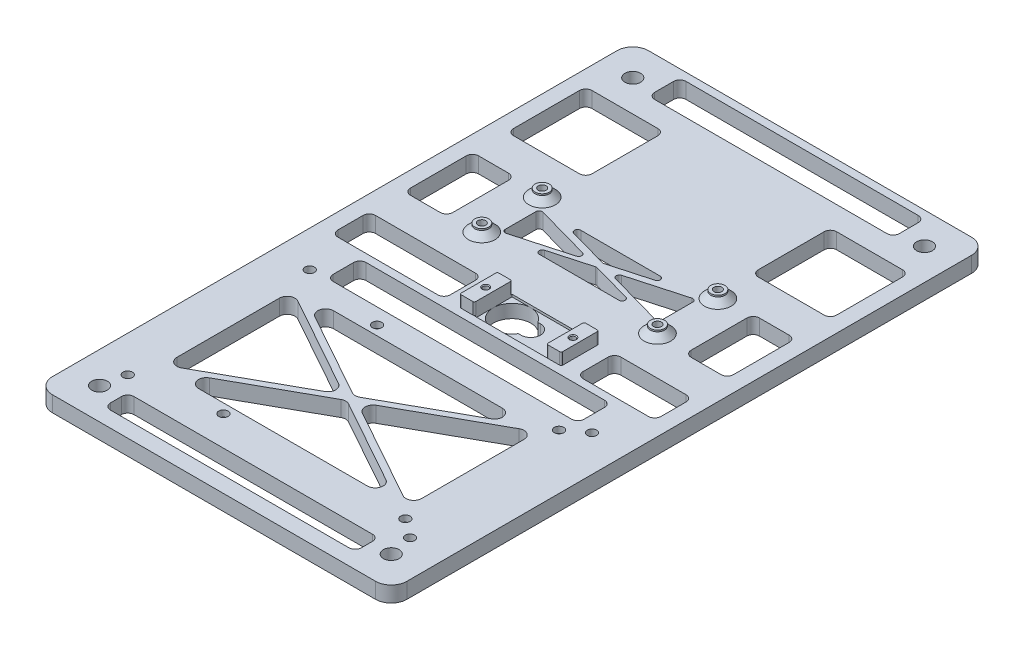
from build123d import *

# Parameters (mm, degrees)
SKETCH1_W           = 113
SKETCH1_H           = 190
SKETCH1_R           = 2.5
BOSS_EXTRUDE1_DEPTH = 5
FILLET1_R           = 5
SKETCH2_R           = 1.5
CUT_EXTRUDE1_DEPTH  = 10
SKETCH3_R           = 1.5
CUT_EXTRUDE2_DEPTH  = 10
CUT_EXTRUDE4_DEPTH  = 10
CUT_EXTRUDE16_DEPTH = 111.644701635
SKETCH22_W          = 23
SKETCH22_H          = 12
CUT_EXTRUDE17_DEPTH = 0.75
SKETCH23_W          = 4.675
SKETCH23_H          = 12
SKETCH23_R          = 0.875
BOSS_EXTRUDE5_DEPTH = 3.75
CUT_EXTRUDE18_START = -1.5
SKETCH24_R          = 0.875
CUT_EXTRUDE18_DEPTH = 1.5
SKETCH12_W          = 25
SKETCH12_H          = 25
CUT_EXTRUDE9_DEPTH  = 111.644701635
CUT_EXTRUDE11_REACH = 112.645
SKETCH15_W          = 35.825
SKETCH15_H          = 12
SKETCH15_W_2        = 24.825
FILLET3_R           = 2
CUT_EXTRUDE12_REACH = 112.877
SKETCH16_R          = 1.25
CUT_EXTRUDE13_REACH = 112.645
CUT_EXTRUDE14_DEPTH = 111.644701635
SKETCH19_R          = 2.25
SKETCH19_R_2        = 1.25
BOSS_EXTRUDE4_DEPTH = 2.5
CHAMFER1_SIZE       = 2
SKETCH20_R          = 2.5
CUT_EXTRUDE15_DEPTH = 3
FILLET4_R           = 0.5
CHAMFER2_SIZE       = 0.25


with BuildPart() as part:
    # Sketch1 → Boss-Extrude1 (new body)
    with BuildSketch(Plane(origin=(0, 0, 0), x_dir=(1, 0, 0), z_dir=(0, 1, 0))):
        Rectangle(SKETCH1_W, SKETCH1_H)
        with Locations((46.5, 85)):
            Circle(SKETCH1_R, mode=Mode.SUBTRACT)
        with Locations((-46.5, 85)):
            Circle(SKETCH1_R, mode=Mode.SUBTRACT)
        with Locations((-46.5, -85)):
            Circle(SKETCH1_R, mode=Mode.SUBTRACT)
        with Locations((46.5, -85)):
            Circle(SKETCH1_R, mode=Mode.SUBTRACT)
    extrude(amount=BOSS_EXTRUDE1_DEPTH)

    # Fillet1
    fillet1_edges = [part.edges().sort_by_distance(p)[0] for p in [
        (-56.5, 2.5, 95),
        (-56.5, 2.5, -95),
        (56.5, 2.5, -95),
        (56.5, 2.5, 95),
    ]]
    fillet(fillet1_edges, radius=FILLET1_R)

    # Sketch2 → Cut-Extrude1 (cut)
    with BuildSketch(Plane(origin=(0, 5, 0), x_dir=(1, 0, 0), z_dir=(0, 1, 0))):
        with Locations((39, -24)):
            Circle(SKETCH2_R)
        with Locations((39, -73)):
            Circle(SKETCH2_R)
        with Locations((-19, -24)):
            Circle(SKETCH2_R)
        with Locations((-19, -73)):
            Circle(SKETCH2_R)
    extrude(amount=-CUT_EXTRUDE1_DEPTH, mode=Mode.SUBTRACT)

    # Sketch3 → Cut-Extrude2 (cut)
    with BuildSketch(Plane(origin=(0, 5, 0), x_dir=(1, 0, 0), z_dir=(0, 1, 0))):
        with Locations((45, -19.5)):
            Circle(SKETCH3_R)
        with Locations((45, -77.5)):
            Circle(SKETCH3_R)
        with Locations((-45, -19.5)):
            Circle(SKETCH3_R)
        with Locations((-45, -77.5)):
            Circle(SKETCH3_R)
    extrude(amount=-CUT_EXTRUDE2_DEPTH, mode=Mode.SUBTRACT)

    # Sketch5 → Cut-Extrude4 (cut)
    with BuildSketch(Plane(origin=(0, 5, 0), x_dir=(1, 0, 0), z_dir=(0, 1, 0))):
        with BuildLine():
            Line((-38, -90), (38, -90))
            ThreePointArc((38, -90), (39.414213562, -89.414213562), (40, -88))
            Line((40, -88), (40, -84.5))
            ThreePointArc((40, -84.5), (39.414213562, -83.085786438), (38, -82.5))
            Line((38, -82.5), (-38, -82.5))
            ThreePointArc((-38, -82.5), (-39.414213562, -83.085786438), (-40, -84.5))
            Line((-40, -84.5), (-40, -88))
            ThreePointArc((-40, -88), (-39.414213562, -89.414213562), (-38, -90))
        make_face()
    extrude(amount=-CUT_EXTRUDE4_DEPTH, mode=Mode.SUBTRACT)

    # Sketch21 → Cut-Extrude16 (cut, through all)
    with BuildSketch(Plane(origin=(0, 5, 0), x_dir=(1, 0, 0), z_dir=(0, 1, 0))):
        with BuildLine():
            Line((5.975, -3.125), (5.121950312, -3.125))
            ThreePointArc((5.121950312, -3.125), (-6, 0), (5.121950312, 3.125))
            Line((5.121950312, 3.125), (5.975, 3.125))
            ThreePointArc((5.975, 3.125), (9.1, 0), (5.975, -3.125))
        make_face()
    extrude(amount=-CUT_EXTRUDE16_DEPTH, mode=Mode.SUBTRACT)

    # Sketch22 → Cut-Extrude17 (cut)
    with BuildSketch(Plane(origin=(0, 5, 0), x_dir=(1, 0, 0), z_dir=(0, 1, 0))):
        with Locations((5.5, 0)):
            Rectangle(SKETCH22_W, SKETCH22_H)
    extrude(amount=-CUT_EXTRUDE17_DEPTH, mode=Mode.SUBTRACT)

    # Sketch23 → Boss-Extrude5 (add)
    # profile 1 of 2: a face of its own
    with BuildSketch(Plane(origin=(0, 5, 0), x_dir=(1, 0, 0), z_dir=(0, 1, 0))):
        with Locations((-8.3375, 0)):
            Rectangle(SKETCH23_W, SKETCH23_H)
        with Locations((-8.4, 0)):
            Circle(SKETCH23_R, mode=Mode.SUBTRACT)
    # profile 2 of 2: a face of its own
    with BuildSketch(Plane(origin=(0, 5, 0), x_dir=(1, 0, 0), z_dir=(0, 1, 0))):
        with Locations((19.3375, 0)):
            Rectangle(SKETCH23_W, SKETCH23_H)
        with Locations((19.4, 0)):
            Circle(SKETCH23_R, mode=Mode.SUBTRACT)
    extrude(amount=BOSS_EXTRUDE5_DEPTH)

    # Sketch24 → Cut-Extrude18 (cut)
    with BuildSketch(Plane(origin=(0, 5, 0), x_dir=(1, 0, 0), z_dir=(0, 1, 0)).offset(CUT_EXTRUDE18_START)):
        with Locations((19.4, 0)):
            Circle(SKETCH24_R)
        with Locations((-8.4, 0)):
            Circle(SKETCH24_R)
    extrude(amount=CUT_EXTRUDE18_DEPTH, mode=Mode.SUBTRACT)

    # Sketch12 → Cut-Extrude9 (cut, through all)
    with BuildSketch(Plane(origin=(0, 5, 0), x_dir=(1, 0, 0), z_dir=(0, 1, 0))):
        with Locations((-39, 62.5)):
            Rectangle(SKETCH12_W, SKETCH12_H)
        with Locations((39, 62.5)):
            Rectangle(SKETCH12_W, SKETCH12_H)
    extrude(amount=-CUT_EXTRUDE9_DEPTH, mode=Mode.SUBTRACT)

    # Sketch15 → Cut-Extrude11 (cut, up to next)
    with BuildSketch(Plane(origin=(0, 5, 0), x_dir=(1, 0, 0), z_dir=(0, 1, 0)), mode=Mode.PRIVATE) as cut_extrude11_sk1:
        with Locations((-33.5875, 0)):
            Rectangle(SKETCH15_W, SKETCH15_H)
    cut_extrude11_tool1 = extrude(cut_extrude11_sk1.sketch, amount=-CUT_EXTRUDE11_REACH, mode=Mode.PRIVATE) & part.part
    # Sketch15 → Cut-Extrude11 (cut, up to next)
    with BuildSketch(Plane(origin=(0, 5, 0), x_dir=(1, 0, 0), z_dir=(0, 1, 0)), mode=Mode.PRIVATE) as cut_extrude11_sk2:
        with Locations((39.0875, 0)):
            Rectangle(SKETCH15_W_2, SKETCH15_H)
    cut_extrude11_tool2 = extrude(cut_extrude11_sk2.sketch, amount=-CUT_EXTRUDE11_REACH, mode=Mode.PRIVATE) & part.part
    add(cut_extrude11_tool1.solids().sort_by_distance((-33.5875, 5, 0))[0], mode=Mode.SUBTRACT)
    add(cut_extrude11_tool2.solids().sort_by_distance((39.0875, 5, 0))[0], mode=Mode.SUBTRACT)

    # Fillet3
    fillet3_edges = [part.edges().sort_by_distance(p)[0] for p in [
        (-51.5, 2.5, 6),
        (-51.5, 2.5, -6),
        (-15.675, 2.5, -6),
        (-15.675, 2.5, 6),
        (51.5, 2.5, -6),
        (26.675, 2.5, -6),
        (26.675, 2.5, 6),
        (51.5, 2.5, 6),
        (51.5, 2.5, -50),
        (51.5, 2.5, -75),
        (26.5, 2.5, -50),
        (26.5, 2.5, -75),
        (-26.5, 2.5, -50),
        (-51.5, 2.5, -50),
        (-51.5, 2.5, -75),
        (-26.5, 2.5, -75),
    ]]
    fillet(fillet3_edges, radius=FILLET3_R)

    # Sketch16 → Cut-Extrude12 (cut, up to next)
    with BuildSketch(Plane.XZ, mode=Mode.PRIVATE) as cut_extrude12_sk1:
        with Locations((-28, -18.375)):
            Circle(SKETCH16_R)
    cut_extrude12_tool1 = extrude(cut_extrude12_sk1.sketch, amount=-CUT_EXTRUDE12_REACH, mode=Mode.PRIVATE) & part.part
    # Sketch16 → Cut-Extrude12 (cut, up to next)
    with BuildSketch(Plane.XZ, mode=Mode.PRIVATE) as cut_extrude12_sk2:
        with Locations((28, -18.375)):
            Circle(SKETCH16_R)
    cut_extrude12_tool2 = extrude(cut_extrude12_sk2.sketch, amount=-CUT_EXTRUDE12_REACH, mode=Mode.PRIVATE) & part.part
    # Sketch16 → Cut-Extrude12 (cut, up to next)
    with BuildSketch(Plane.XZ, mode=Mode.PRIVATE) as cut_extrude12_sk3:
        with Locations((28, -37.625)):
            Circle(SKETCH16_R)
    cut_extrude12_tool3 = extrude(cut_extrude12_sk3.sketch, amount=-CUT_EXTRUDE12_REACH, mode=Mode.PRIVATE) & part.part
    # Sketch16 → Cut-Extrude12 (cut, up to next)
    with BuildSketch(Plane.XZ, mode=Mode.PRIVATE) as cut_extrude12_sk4:
        with Locations((-28, -37.625)):
            Circle(SKETCH16_R)
    cut_extrude12_tool4 = extrude(cut_extrude12_sk4.sketch, amount=-CUT_EXTRUDE12_REACH, mode=Mode.PRIVATE) & part.part
    # Sketch16 → Cut-Extrude12 (cut, up to next)
    with BuildSketch(Plane.XZ, mode=Mode.PRIVATE) as cut_extrude12_sk5:
        with BuildLine():
            Line((-42, 64.8228648), (-42, 32.1771352))
            ThreePointArc((-42, 32.1771352), (-40.766661958, 30.021777345), (-38.283546013, 29.993047359))
            Line((-38.283546013, 29.993047359), (-8.976584213, 46.315912159))
            ThreePointArc((-8.976584213, 46.315912159), (-7.6930382, 48.5), (-8.976584213, 50.684087841))
            Line((-8.976584213, 50.684087841), (-38.283546013, 67.006952641))
            ThreePointArc((-38.283546013, 67.006952641), (-40.766661958, 66.978222655), (-42, 64.8228648))
        make_face()
    cut_extrude12_tool5 = extrude(cut_extrude12_sk5.sketch, amount=-CUT_EXTRUDE12_REACH, mode=Mode.PRIVATE) & part.part
    # Sketch16 → Cut-Extrude12 (cut, up to next)
    with BuildSketch(Plane.XZ, mode=Mode.PRIVATE) as cut_extrude12_sk6:
        with BuildLine():
            Line((-31.13705215, 31.684087841), (-4.216453987, 46.677838717))
            ThreePointArc((-4.216453987, 46.677838717), (-3, 46.993750876), (-1.783546013, 46.677838717))
            Line((-1.783546013, 46.677838717), (25.13705215, 31.684087841))
            ThreePointArc((25.13705215, 31.684087841), (26.340331578, 28.871597105), (23.920598163, 27))
            Line((23.920598163, 27), (-29.920598163, 27))
            ThreePointArc((-29.920598163, 27), (-32.340331578, 28.871597105), (-31.13705215, 31.684087841))
        make_face()
    cut_extrude12_tool6 = extrude(cut_extrude12_sk6.sketch, amount=-CUT_EXTRUDE12_REACH, mode=Mode.PRIVATE) & part.part
    # Sketch16 → Cut-Extrude12 (cut, up to next)
    with BuildSketch(Plane.XZ, mode=Mode.PRIVATE) as cut_extrude12_sk7:
        with BuildLine():
            Line((32.283546013, 29.993047359), (2.976584213, 46.315912159))
            ThreePointArc((2.976584213, 46.315912159), (1.6930382, 48.5), (2.976584213, 50.684087841))
            Line((2.976584213, 50.684087841), (32.283546013, 67.006952641))
            ThreePointArc((32.283546013, 67.006952641), (34.766661958, 66.978222655), (36, 64.8228648))
            Line((36, 64.8228648), (36, 32.1771352))
            ThreePointArc((36, 32.1771352), (34.766661958, 30.021777345), (32.283546013, 29.993047359))
        make_face()
    cut_extrude12_tool7 = extrude(cut_extrude12_sk7.sketch, amount=-CUT_EXTRUDE12_REACH, mode=Mode.PRIVATE) & part.part
    # Sketch16 → Cut-Extrude12 (cut, up to next)
    with BuildSketch(Plane.XZ, mode=Mode.PRIVATE) as cut_extrude12_sk8:
        with BuildLine():
            Line((-1.783546013, 50.322161283), (25.13705215, 65.315912159))
            ThreePointArc((25.13705215, 65.315912159), (26.340331578, 68.128402895), (23.920598163, 70))
            Line((23.920598163, 70), (-29.920598163, 70))
            ThreePointArc((-29.920598163, 70), (-32.340331578, 68.128402895), (-31.13705215, 65.315912159))
            Line((-31.13705215, 65.315912159), (-4.216453987, 50.322161283))
            ThreePointArc((-4.216453987, 50.322161283), (-3, 50.006249124), (-1.783546013, 50.322161283))
        make_face()
    cut_extrude12_tool8 = extrude(cut_extrude12_sk8.sketch, amount=-CUT_EXTRUDE12_REACH, mode=Mode.PRIVATE) & part.part
    # Sketch16 → Cut-Extrude12 (cut, up to next)
    with BuildSketch(Plane.XZ, mode=Mode.PRIVATE) as cut_extrude12_sk9:
        with BuildLine():
            Line((-37, -82.5), (37, -82.5))
            ThreePointArc((37, -82.5), (38.414213562, -83.085786438), (39, -84.5))
            Line((39, -84.5), (39, -90.5))
            ThreePointArc((39, -90.5), (38.414213562, -91.914213562), (37, -92.5))
            Line((37, -92.5), (-37, -92.5))
            ThreePointArc((-37, -92.5), (-38.414213562, -91.914213562), (-39, -90.5))
            Line((-39, -90.5), (-39, -84.5))
            ThreePointArc((-39, -84.5), (-38.414213562, -83.085786438), (-37, -82.5))
        make_face()
    cut_extrude12_tool9 = extrude(cut_extrude12_sk9.sketch, amount=-CUT_EXTRUDE12_REACH, mode=Mode.PRIVATE) & part.part
    add(cut_extrude12_tool1.solids().sort_by_distance((-28, 0, -18.375))[0], mode=Mode.SUBTRACT)
    add(cut_extrude12_tool2.solids().sort_by_distance((28, 0, -18.375))[0], mode=Mode.SUBTRACT)
    add(cut_extrude12_tool3.solids().sort_by_distance((28, 0, -37.625))[0], mode=Mode.SUBTRACT)
    add(cut_extrude12_tool4.solids().sort_by_distance((-28, 0, -37.625))[0], mode=Mode.SUBTRACT)
    add(cut_extrude12_tool5.solids().sort_by_distance((-29.697812, 0, 48.5))[0], mode=Mode.SUBTRACT)
    add(cut_extrude12_tool6.solids().sort_by_distance((-3, 0, 34.022847))[0], mode=Mode.SUBTRACT)
    add(cut_extrude12_tool7.solids().sort_by_distance((23.697812, 0, 48.5))[0], mode=Mode.SUBTRACT)
    add(cut_extrude12_tool8.solids().sort_by_distance((-3, 0, 62.977153))[0], mode=Mode.SUBTRACT)
    add(cut_extrude12_tool9.solids().sort_by_distance((0, 0, -87.5))[0], mode=Mode.SUBTRACT)

    # Sketch17 → Cut-Extrude13 (cut, up to next)
    with BuildSketch(Plane(origin=(0, 5, 0), x_dir=(1, 0, 0), z_dir=(0, 1, 0)), mode=Mode.PRIVATE) as cut_extrude13_sk1:
        with BuildLine():
            Line((-40, 38.875), (-49.5, 38.875))
            ThreePointArc((-49.5, 38.875), (-50.914213562, 38.289213562), (-51.5, 36.875))
            Line((-51.5, 36.875), (-51.5, 19.125))
            ThreePointArc((-51.5, 19.125), (-50.914213562, 17.710786438), (-49.5, 17.125))
            Line((-49.5, 17.125), (-40, 17.125))
            ThreePointArc((-40, 17.125), (-38.585786438, 17.710786438), (-38, 19.125))
            Line((-38, 19.125), (-38, 36.875))
            ThreePointArc((-38, 36.875), (-38.585786438, 38.289213562), (-40, 38.875))
        make_face()
    cut_extrude13_tool1 = extrude(cut_extrude13_sk1.sketch, amount=-CUT_EXTRUDE13_REACH, mode=Mode.PRIVATE) & part.part
    # Sketch17 → Cut-Extrude13 (cut, up to next)
    with BuildSketch(Plane(origin=(0, 5, 0), x_dir=(1, 0, 0), z_dir=(0, 1, 0)), mode=Mode.PRIVATE) as cut_extrude13_sk2:
        with BuildLine():
            Line((40, 17.125), (49.5, 17.125))
            ThreePointArc((49.5, 17.125), (50.914213562, 17.710786438), (51.5, 19.125))
            Line((51.5, 19.125), (51.5, 36.875))
            ThreePointArc((51.5, 36.875), (50.914213562, 38.289213562), (49.5, 38.875))
            Line((49.5, 38.875), (40, 38.875))
            ThreePointArc((40, 38.875), (38.585786438, 38.289213562), (38, 36.875))
            Line((38, 36.875), (38, 19.125))
            ThreePointArc((38, 19.125), (38.585786438, 17.710786438), (40, 17.125))
        make_face()
    cut_extrude13_tool2 = extrude(cut_extrude13_sk2.sketch, amount=-CUT_EXTRUDE13_REACH, mode=Mode.PRIVATE) & part.part
    add(cut_extrude13_tool1.solids().sort_by_distance((-44.75, 5, -28))[0], mode=Mode.SUBTRACT)
    add(cut_extrude13_tool2.solids().sort_by_distance((44.75, 5, -28))[0], mode=Mode.SUBTRACT)

    # Sketch18 → Cut-Extrude14 (cut, through all)
    with BuildSketch(Plane(origin=(0, 5, 0), x_dir=(1, 0, 0), z_dir=(0, 1, 0))):
        with BuildLine():
            Line((-25, 32.629278458), (-25, 22.851570568))
            ThreePointArc((-25, 22.851570568), (-24.60452273, 22.054982677), (-23.730895463, 21.888459594))
            Line((-23.730895463, 21.888459594), (-6.233944503, 26.777313539))
            ThreePointArc((-6.233944503, 26.777313539), (-5.50304904, 27.740424513), (-6.233944503, 28.703535487))
            Line((-6.233944503, 28.703535487), (-23.730895463, 33.592389432))
            ThreePointArc((-23.730895463, 33.592389432), (-24.60452273, 33.425866349), (-25, 32.629278458))
        make_face()
        with BuildLine():
            Line((-12.699522902, 34.625), (12.699522902, 34.625))
            ThreePointArc((12.699522902, 34.625), (13.690257724, 33.760810578), (12.968627439, 32.661889026))
            Line((12.968627439, 32.661889026), (0.269104537, 29.113492921))
            ThreePointArc((0.269104537, 29.113492921), (0, 29.076603895), (-0.269104537, 29.113492921))
            Line((-0.269104537, 29.113492921), (-12.968627439, 32.661889026))
            ThreePointArc((-12.968627439, 32.661889026), (-13.690257724, 33.760810578), (-12.699522902, 34.625))
        make_face()
        with BuildLine():
            Line((23.730895463, 21.888459594), (6.233944503, 26.777313539))
            ThreePointArc((6.233944503, 26.777313539), (5.50304904, 27.740424513), (6.233944503, 28.703535487))
            Line((6.233944503, 28.703535487), (23.730895463, 33.592389432))
            ThreePointArc((23.730895463, 33.592389432), (24.60452273, 33.425866349), (25, 32.629278458))
            Line((25, 32.629278458), (25, 22.851570568))
            ThreePointArc((25, 22.851570568), (24.60452273, 22.054982677), (23.730895463, 21.888459594))
        make_face()
        with BuildLine():
            Line((12.968627439, 23.338110974), (0.269104537, 26.886507079))
            ThreePointArc((0.269104537, 26.886507079), (0, 26.923396105), (-0.269104537, 26.886507079))
            Line((-0.269104537, 26.886507079), (-12.968627439, 23.338110974))
            ThreePointArc((-12.968627439, 23.338110974), (-13.690257724, 22.239189422), (-12.699522902, 21.375))
            Line((-12.699522902, 21.375), (12.699522902, 21.375))
            ThreePointArc((12.699522902, 21.375), (13.690257724, 22.239189422), (12.968627439, 23.338110974))
        make_face()
        with BuildLine():
            Line((-38, -8.5), (38, -8.5))
            ThreePointArc((38, -8.5), (39.414213562, -9.085786438), (40, -10.5))
            Line((40, -10.5), (40, -17))
            ThreePointArc((40, -17), (39.414213562, -18.414213562), (38, -19))
            Line((38, -19), (-38, -19))
            ThreePointArc((-38, -19), (-39.414213562, -18.414213562), (-40, -17))
            Line((-40, -17), (-40, -10.5))
            ThreePointArc((-40, -10.5), (-39.414213562, -9.085786438), (-38, -8.5))
        make_face()
    extrude(amount=-CUT_EXTRUDE14_DEPTH, mode=Mode.SUBTRACT)

    # Sketch19 → Boss-Extrude4 (add)
    # profile 1 of 4: a face of its own
    with BuildSketch(Plane(origin=(0, 5, 0), x_dir=(1, 0, 0), z_dir=(0, 1, 0))):
        with Locations((-28, 37.625)):
            Circle(SKETCH19_R)
        with Locations((-28, 37.625)):
            Circle(SKETCH19_R_2, mode=Mode.SUBTRACT)
    # profile 2 of 4: a face of its own
    with BuildSketch(Plane(origin=(0, 5, 0), x_dir=(1, 0, 0), z_dir=(0, 1, 0))):
        with Locations((-28, 18.375)):
            Circle(SKETCH19_R)
        with Locations((-28, 18.375)):
            Circle(SKETCH19_R_2, mode=Mode.SUBTRACT)
    # profile 3 of 4: a face of its own
    with BuildSketch(Plane(origin=(0, 5, 0), x_dir=(1, 0, 0), z_dir=(0, 1, 0))):
        with Locations((28, 37.625)):
            Circle(SKETCH19_R)
        with Locations((28, 37.625)):
            Circle(SKETCH19_R_2, mode=Mode.SUBTRACT)
    # profile 4 of 4: a face of its own
    with BuildSketch(Plane(origin=(0, 5, 0), x_dir=(1, 0, 0), z_dir=(0, 1, 0))):
        with Locations((28, 18.375)):
            Circle(SKETCH19_R)
        with Locations((28, 18.375)):
            Circle(SKETCH19_R_2, mode=Mode.SUBTRACT)
    extrude(amount=BOSS_EXTRUDE4_DEPTH)

    # Chamfer1
    chamfer1_edges = [part.edges().sort_by_distance(p)[0] for p in [
        (-30.25, 5, -37.625),
        (-30.25, 5, -18.375),
        (25.75, 5, -18.375),
        (25.75, 5, -37.625),
    ]]
    chamfer(chamfer1_edges, length=CHAMFER1_SIZE)

    # Sketch20 → Cut-Extrude15 (cut)
    with BuildSketch(Plane.XZ):
        with Locations((-19, 73)):
            Circle(SKETCH20_R)
        with Locations((-19, 24)):
            Circle(SKETCH20_R)
        with Locations((39, 24)):
            Circle(SKETCH20_R)
        with Locations((39, 73)):
            Circle(SKETCH20_R)
    extrude(amount=-CUT_EXTRUDE15_DEPTH, mode=Mode.SUBTRACT)

    # Fillet4
    fillet4_edges = [part.edges().sort_by_distance(p)[0] for p in [
        (21.675, 6.875, -6),
        (17, 6.875, -6),
        (-10.675, 6.875, -6),
        (-6, 6.875, -6),
        (17, 6.875, 6),
        (-6, 6.875, 6),
        (21.675, 6.875, 6),
        (-10.675, 6.875, 6),
    ]]
    fillet(fillet4_edges, radius=FILLET4_R)

    # Chamfer2
    chamfer2_edges = [part.edges().sort_by_distance(p)[0] for p in [
        (-9.275, 8.75, 0),
        (18.525, 8.75, 0),
    ]]
    chamfer(chamfer2_edges, length=CHAMFER2_SIZE)


solid = part.part
